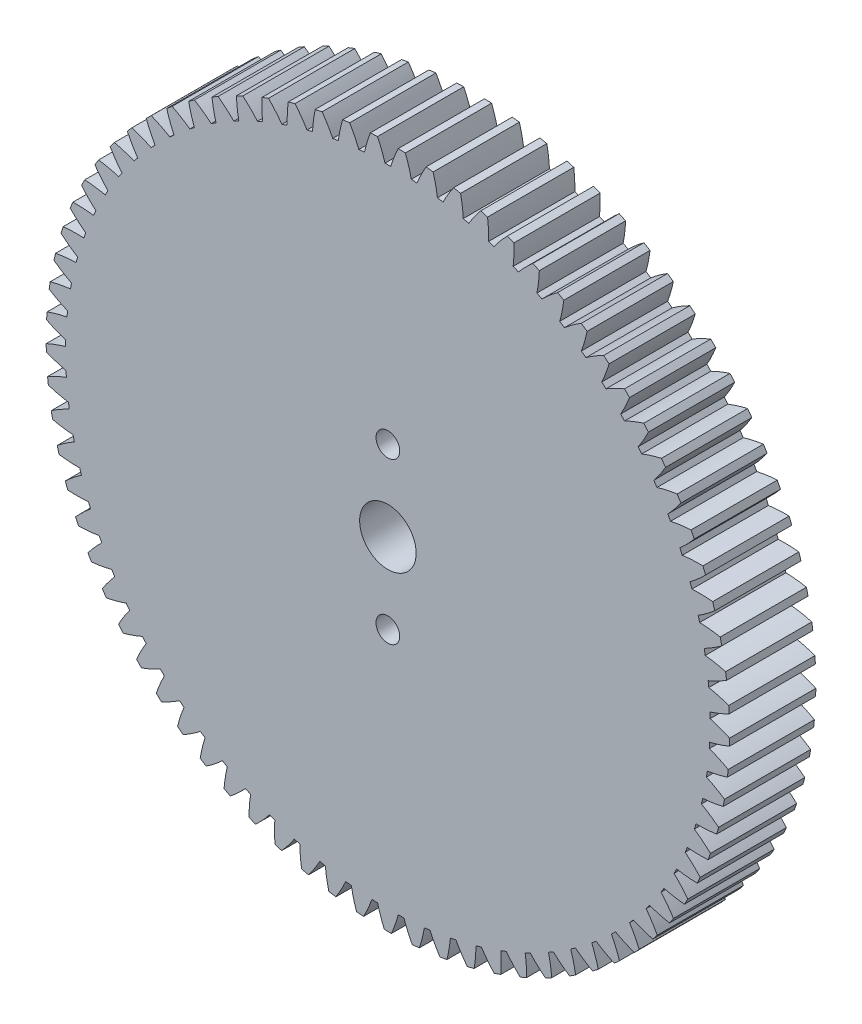
from build123d import *

# Parameters (mm, degrees)
MODEL_R             = 1.375
MODEL_R_2           = 3.275
BOSS_EXTRUDE1_DEPTH = 10


with BuildPart() as part:
    # Model → Boss-Extrude1 (new body)
    with BuildSketch(Plane.XY):
        with BuildLine():
            ThreePointArc((-39.573855354, 2.012609605), (-38.483782884, 1.509137576), (-37.358060536, 1.091416054))
            ThreePointArc((-37.358060536, 1.091416054), (-37.366223524, 0.762374936), (-37.371488451, 0.433274691))
            ThreePointArc((-37.371488451, 0.433274691), (-38.513312242, 0.06181742), (-39.623013466, -0.396773105))
            ThreePointArc((-39.623013466, -0.396773105), (-39.616755155, -0.808292044), (-39.606222982, -1.219723785))
            ThreePointArc((-39.606222982, -1.219723785), (-38.478739993, -1.632669526), (-37.322715212, -1.957244292))
            ThreePointArc((-37.322715212, -1.957244292), (-37.304031133, -2.285855912), (-37.282453816, -2.614290244))
            ThreePointArc((-37.282453816, -2.614290244), (-38.390201066, -3.077580761), (-39.458830466, -3.625096314))
            ThreePointArc((-39.458830466, -3.625096314), (-39.419050364, -4.034735848), (-39.37501773, -4.443940114))
            ThreePointArc((-39.37501773, -4.443940114), (-38.217627437, -4.763611481), (-37.038993376, -4.9928795))
            ThreePointArc((-37.038993376, -4.9928795), (-36.993586569, -5.318874766), (-36.945310601, -5.644457508))
            ThreePointArc((-36.945310601, -5.644457508), (-38.011609436, -6.196498149), (-39.032055459, -6.829295106))
            ThreePointArc((-39.032055459, -6.829295106), (-38.959018298, -7.234329151), (-38.881778232, -7.638582755))
            ThreePointArc((-38.881778232, -7.638582755), (-37.702182875, -7.862852388), (-36.50878315, -7.995287919))
            ThreePointArc((-36.50878315, -7.995287919), (-36.43695579, -8.316497386), (-36.362302441, -8.637061839))
            ThreePointArc((-36.362302441, -8.637061839), (-37.380056817, -9.274178864), (-38.345528563, -9.988046066))
            ThreePointArc((-38.345528563, -9.988046066), (-38.239720392, -10.385779186), (-38.129786915, -10.782391887))
            ThreePointArc((-38.129786915, -10.782391887), (-36.935836507, -10.90976731), (-35.735612996, -10.944489016))
            ThreePointArc((-35.735612996, -10.944489016), (-35.637843082, -11.258775088), (-35.537309157, -11.572187948))
            ThreePointArc((-35.537309157, -11.572187948), (-36.499746087, -12.290141449), (-37.403818501, -13.080328227))
            ThreePointArc((-37.403818501, -13.080328227), (-37.265943457, -13.468113575), (-37.124048157, -13.854445981))
            ThreePointArc((-37.124048157, -13.854445981), (-35.923688241, -13.88407953), (-34.724628233, -13.820856344))
            ThreePointArc((-34.724628233, -13.820856344), (-34.601566408, -14.126127499), (-34.475820943, -14.430303056))
            ThreePointArc((-34.475820943, -14.430303056), (-35.376535569, -15.22431517), (-36.213192198, -16.085562962))
            ThreePointArc((-36.213192198, -16.085562962), (-36.044167816, -16.46081989), (-35.871254983, -16.834301023))
            ThreePointArc((-35.871254983, -16.834301023), (-34.672473757, -16.765995492), (-33.482556799, -16.605248153))
            ThreePointArc((-33.482556799, -16.605248153), (-33.335022018, -16.899472863), (-33.18490183, -17.192386878))
            ThreePointArc((-33.18490183, -17.192386878), (-34.017900043, -18.057173586), (-34.781573076, -18.983750929))
            ThreePointArc((-34.781573076, -18.983750929), (-34.582524185, -19.343982165), (-34.379744526, -19.702126568))
            ThreePointArc((-34.379744526, -19.702126568), (-33.19051968, -19.53633652), (-32.017664473, -19.279134776))
            ThreePointArc((-32.017664473, -19.279134776), (-31.846638557, -19.560355023), (-31.673142669, -19.840058201))
            ThreePointArc((-31.673142669, -19.840058201), (-32.432881005, -20.769864491), (-33.118488324, -21.755605166))
            ThreePointArc((-33.118488324, -21.755605166), (-32.890739561, -22.098413429), (-32.659442541, -22.438837712))
            ThreePointArc((-32.659442541, -22.438837712), (-31.487688171, -22.176666451), (-30.339699873, -21.824721937))
            ThreePointArc((-30.339699873, -21.824721937), (-30.146320971, -22.091066247), (-29.95060397, -22.355697211))
            ThreePointArc((-29.95060397, -22.355697211), (-30.632026495, -23.344335374), (-31.235005496, -24.38267944))
            ThreePointArc((-31.235005496, -24.38267944), (-30.980072493, -24.705783399), (-30.721797355, -25.026222094))
            ThreePointArc((-30.721797355, -25.026222094), (-29.575311292, -24.669414326), (-28.459829575, -24.225069175))
            ThreePointArc((-28.459829575, -24.225069175), (-28.245384592, -24.47476507), (-28.028748944, -24.722562744))
            ThreePointArc((-28.028748944, -24.722562744), (-28.627320902, -25.763453557), (-29.143658859, -26.847491005))
            ThreePointArc((-29.143658859, -26.847491005), (-28.863238153, -27.148740455), (-28.579703676, -27.447061096))
            ThreePointArc((-28.579703676, -27.447061096), (-27.466115596, -26.997991319), (-26.390563808, -26.464202574))
            ThreePointArc((-26.390563808, -26.464202574), (-26.156479839, -26.69558837), (-25.920367217, -26.924903701))
            ThreePointArc((-25.920367217, -26.924903701), (-26.432105212, -28.011120207), (-26.858365982, -29.133636947))
            ThreePointArc((-26.858365982, -29.133636947), (-26.554323725, -29.411027124), (-26.247416784, -29.685244435))
            ThreePointArc((-26.247416784, -29.685244435), (-25.174137433, -29.146901134), (-24.145673192, -28.527221072))
            ThreePointArc((-24.145673192, -28.527221072), (-23.893508028, -28.738756934), (-23.639489723, -28.948063866))
            ThreePointArc((-23.639489723, -28.948063866), (-24.060988223, -30.072377474), (-24.39433511, -31.225903342))
            ThreePointArc((-24.39433511, -31.225903342), (-24.068694654, -31.477588259), (-23.740457664, -31.72587737))
            ThreePointArc((-23.740457664, -31.72587737), (-22.714629538, -31.101843131), (-21.740097106, -30.400395619))
            ThreePointArc((-21.740097106, -30.400395619), (-21.471528863, -30.590673812), (-21.201295325, -30.778579443))
            ThreePointArc((-21.201295325, -30.778579443), (-21.529749327, -31.93350803), (-21.767963963, -33.110366502))
            ThreePointArc((-21.767963963, -33.110366502), (-21.422892392, -33.334671238), (-21.075509715, -33.555379825))
            ThreePointArc((-21.075509715, -33.555379825), (-20.103959532, -32.849807494), (-19.189844259, -32.07126055))
            ThreePointArc((-19.189844259, -32.07126055), (-18.906660217, -32.239014802), (-18.622009805, -32.404268651))
            ThreePointArc((-18.622009805, -32.404268651), (-18.855233502, -33.582126359), (-18.996730607, -34.774485636))
            ThreePointArc((-18.996730607, -34.774485636), (-18.634524314, -34.96991748), (-18.270307727, -35.161576764))
            ThreePointArc((-18.270307727, -35.161576764), (-17.359500991, -34.379161807), (-16.511886166, -33.528696533))
            ThreePointArc((-16.511886166, -33.528696533), (-16.215970866, -33.672810469), (-15.918797882, -33.814312797))
            ThreePointArc((-15.918797882, -33.814312797), (-16.055239208, -35.007261178), (-16.099077143, -36.207186305))
            ThreePointArc((-16.099077143, -36.207186305), (-15.722146553, -36.37244469), (-15.343519855, -36.533779211))
            ThreePointArc((-15.343519855, -36.533779211), (-14.499517836, -35.679728471), (-13.724044194, -34.763004573))
            ThreePointArc((-13.724044194, -34.763004573), (-13.417366904, -34.882519137), (-13.109648986, -34.999328271))
            ThreePointArc((-13.109648986, -34.999328271), (-13.148399947, -36.19942845), (-13.094286977, -37.398934123))
            ThreePointArc((-13.094286977, -37.398934123), (-12.705140499, -37.532919283), (-12.314623389, -37.662855385))
            ThreePointArc((-12.314623389, -37.662855385), (-11.543042782, -36.742852429), (-10.844870973, -35.765970553))
            ThreePointArc((-10.844870973, -35.765970553), (-10.529472579, -35.860090396), (-10.213257538, -35.951428991))
            ThreePointArc((-10.213257538, -35.951428991), (-10.154060253, -37.150694497), (-10.002356492, -38.341798205))
            ThreePointArc((-10.002356492, -38.341798205), (-9.603583832, -38.44361849), (-9.203775137, -38.541291471))
            ThreePointArc((-9.203775137, -38.541291471), (-8.509750682, -37.561458765), (-7.893526924, -36.530919899))
            ThreePointArc((-7.893526924, -36.530919899), (-7.571506352, -36.599018669), (-7.248898547, -36.664278881))
            ThreePointArc((-7.248898547, -36.664278881), (-7.092146963, -37.854728802), (-6.843861974, -39.029503946))
            ThreePointArc((-6.843861974, -39.029503946), (-6.438116899, -39.098481758), (-6.03167728, -39.16324162))
            ThreePointArc((-6.03167728, -39.16324162), (-5.419827596, -38.130099791), (-4.889652756, -37.052762001))
            ThreePointArc((-4.889652756, -37.052762001), (-4.563152999, -37.094386512), (-4.236299331, -37.133134045))
            ThreePointArc((-4.236299331, -37.133134045), (-3.983036606, -38.306846133), (-3.639822684, -39.457474778))
            ThreePointArc((-3.639822684, -39.457474778), (-3.229805361, -39.493151081), (-2.819439605, -39.524566858))
            ThreePointArc((-2.819439605, -39.524566858), (-2.293836451, -38.444991294), (-1.853238756, -37.328024085))
            ThreePointArc((-1.853238756, -37.328024085), (-1.524432615, -37.342897333), (-1.195508243, -37.354874328))
            ThreePointArc((-1.195508243, -37.354874328), (-0.847419797, -38.504037723), (-0.411560974, -39.622862625))
            ThreePointArc((-0.411560974, -39.622862625), (0, -39.625), (0.411560974, -39.622862625))
            ThreePointArc((0.411560974, -39.622862625), (0.847419797, -38.504037723), (1.195508243, -37.354874328))
            ThreePointArc((1.195508243, -37.354874328), (1.524432615, -37.342897333), (1.853238756, -37.328024085))
            ThreePointArc((1.853238756, -37.328024085), (2.293836451, -38.444991294), (2.819439605, -39.524566858))
            ThreePointArc((2.819439605, -39.524566858), (3.229805361, -39.493151081), (3.639822684, -39.457474778))
            ThreePointArc((3.639822684, -39.457474778), (3.983036606, -38.306846133), (4.236299331, -37.133134045))
            ThreePointArc((4.236299331, -37.133134045), (4.563152999, -37.094386512), (4.889652756, -37.052762001))
            ThreePointArc((4.889652756, -37.052762001), (5.419827596, -38.130099791), (6.03167728, -39.16324162))
            ThreePointArc((6.03167728, -39.16324162), (6.438116899, -39.098481758), (6.843861974, -39.029503946))
            ThreePointArc((6.843861974, -39.029503946), (7.092146963, -37.854728802), (7.248898547, -36.664278881))
            ThreePointArc((7.248898547, -36.664278881), (7.571506352, -36.599018669), (7.893526924, -36.530919899))
            ThreePointArc((7.893526924, -36.530919899), (8.509750682, -37.561458765), (9.203775137, -38.541291471))
            ThreePointArc((9.203775137, -38.541291471), (9.603583832, -38.44361849), (10.002356491, -38.341798205))
            ThreePointArc((10.002356491, -38.341798205), (10.154060253, -37.150694497), (10.213257538, -35.951428991))
            ThreePointArc((10.213257538, -35.951428991), (10.529472579, -35.860090396), (10.844870973, -35.765970553))
            ThreePointArc((10.844870973, -35.765970553), (11.543042782, -36.742852429), (12.314623389, -37.662855385))
            ThreePointArc((12.314623389, -37.662855385), (12.705140499, -37.532919283), (13.094286977, -37.398934123))
            ThreePointArc((13.094286977, -37.398934123), (13.148399947, -36.19942845), (13.109648986, -34.999328272))
            ThreePointArc((13.109648986, -34.999328272), (13.417366904, -34.882519137), (13.724044194, -34.763004573))
            ThreePointArc((13.724044194, -34.763004573), (14.499517836, -35.679728471), (15.343519855, -36.533779211))
            ThreePointArc((15.343519855, -36.533779211), (15.722146553, -36.372444691), (16.099077143, -36.207186305))
            ThreePointArc((16.099077143, -36.207186305), (16.055239208, -35.007261178), (15.918797882, -33.814312798))
            ThreePointArc((15.918797882, -33.814312798), (16.215970866, -33.672810469), (16.511886166, -33.528696534))
            ThreePointArc((16.511886166, -33.528696534), (17.359500991, -34.379161808), (18.270307727, -35.161576764))
            ThreePointArc((18.270307727, -35.161576764), (18.634524315, -34.96991748), (18.996730607, -34.774485636))
            ThreePointArc((18.996730607, -34.774485636), (18.855233502, -33.58212636), (18.622009805, -32.404268651))
            ThreePointArc((18.622009805, -32.404268651), (18.906660217, -32.239014803), (19.18984426, -32.07126055))
            ThreePointArc((19.18984426, -32.07126055), (20.103959532, -32.849807494), (21.075509716, -33.555379825))
            ThreePointArc((21.075509716, -33.555379825), (21.422892392, -33.334671238), (21.767963963, -33.110366502))
            ThreePointArc((21.767963963, -33.110366502), (21.529749328, -31.933508031), (21.201295325, -30.778579443))
            ThreePointArc((21.201295325, -30.778579443), (21.471528863, -30.590673812), (21.740097106, -30.40039562))
            ThreePointArc((21.740097106, -30.40039562), (22.714629538, -31.101843132), (23.740457664, -31.72587737))
            ThreePointArc((23.740457664, -31.72587737), (24.068694654, -31.477588259), (24.39433511, -31.225903342))
            ThreePointArc((24.39433511, -31.225903342), (24.060988224, -30.072377474), (23.639489723, -28.948063867))
            ThreePointArc((23.639489723, -28.948063867), (23.893508028, -28.738756934), (24.145673193, -28.527221072))
            ThreePointArc((24.145673193, -28.527221072), (25.174137433, -29.146901135), (26.247416784, -29.685244435))
            ThreePointArc((26.247416784, -29.685244435), (26.554323725, -29.411027124), (26.858365982, -29.133636947))
            ThreePointArc((26.858365982, -29.133636947), (26.432105213, -28.011120208), (25.920367217, -26.924903701))
            ThreePointArc((25.920367217, -26.924903701), (26.156479839, -26.69558837), (26.390563808, -26.464202574))
            ThreePointArc((26.390563808, -26.464202574), (27.466115597, -26.99799132), (28.579703676, -27.447061096))
            ThreePointArc((28.579703676, -27.447061096), (28.863238153, -27.148740456), (29.14365886, -26.847491005))
            ThreePointArc((29.14365886, -26.847491005), (28.627320903, -25.763453557), (28.028748944, -24.722562744))
            ThreePointArc((28.028748944, -24.722562744), (28.245384592, -24.47476507), (28.459829575, -24.225069175))
            ThreePointArc((28.459829575, -24.225069175), (29.575311292, -24.669414327), (30.721797355, -25.026222094))
            ThreePointArc((30.721797355, -25.026222094), (30.980072493, -24.705783399), (31.235005496, -24.38267944))
            ThreePointArc((31.235005496, -24.38267944), (30.632026495, -23.344335374), (29.950603971, -22.355697211))
            ThreePointArc((29.950603971, -22.355697211), (30.146320971, -22.091066247), (30.339699873, -21.824721937))
            ThreePointArc((30.339699873, -21.824721937), (31.487688171, -22.176666451), (32.659442541, -22.438837712))
            ThreePointArc((32.659442541, -22.438837712), (32.890739562, -22.098413429), (33.118488324, -21.755605166))
            ThreePointArc((33.118488324, -21.755605166), (32.432881005, -20.769864491), (31.673142669, -19.840058201))
            ThreePointArc((31.673142669, -19.840058201), (31.846638557, -19.560355023), (32.017664473, -19.279134776))
            ThreePointArc((32.017664473, -19.279134776), (33.19051968, -19.53633652), (34.379744526, -19.702126568))
            ThreePointArc((34.379744526, -19.702126568), (34.582524185, -19.343982165), (34.781573076, -18.983750929))
            ThreePointArc((34.781573076, -18.983750929), (34.017900043, -18.057173586), (33.18490183, -17.192386878))
            ThreePointArc((33.18490183, -17.192386878), (33.335022018, -16.899472863), (33.482556799, -16.605248153))
            ThreePointArc((33.482556799, -16.605248153), (34.672473757, -16.765995492), (35.871254983, -16.834301023))
            ThreePointArc((35.871254983, -16.834301023), (36.044167816, -16.46081989), (36.213192198, -16.085562962))
            ThreePointArc((36.213192198, -16.085562962), (35.376535569, -15.22431517), (34.475820943, -14.430303056))
            ThreePointArc((34.475820943, -14.430303056), (34.601566408, -14.126127499), (34.724628233, -13.820856344))
            ThreePointArc((34.724628233, -13.820856344), (35.923688241, -13.88407953), (37.124048157, -13.854445981))
            ThreePointArc((37.124048157, -13.854445981), (37.265943457, -13.468113575), (37.403818501, -13.080328227))
            ThreePointArc((37.403818501, -13.080328227), (36.499746087, -12.290141449), (35.537309157, -11.572187948))
            ThreePointArc((35.537309157, -11.572187948), (35.637843082, -11.258775088), (35.735612996, -10.944489016))
            ThreePointArc((35.735612996, -10.944489016), (36.935836507, -10.90976731), (38.129786915, -10.782391887))
            ThreePointArc((38.129786915, -10.782391887), (38.239720392, -10.385779186), (38.345528563, -9.988046066))
            ThreePointArc((38.345528563, -9.988046066), (37.380056817, -9.274178864), (36.362302441, -8.637061839))
            ThreePointArc((36.362302441, -8.637061839), (36.43695579, -8.316497386), (36.50878315, -7.995287919))
            ThreePointArc((36.50878315, -7.995287919), (37.702182875, -7.862852388), (38.881778232, -7.638582755))
            ThreePointArc((38.881778232, -7.638582755), (38.959018298, -7.234329151), (39.032055459, -6.829295106))
            ThreePointArc((39.032055459, -6.829295106), (38.011609436, -6.196498149), (36.945310601, -5.644457508))
            ThreePointArc((36.945310601, -5.644457508), (36.993586569, -5.318874766), (37.038993376, -4.9928795))
            ThreePointArc((37.038993376, -4.9928795), (38.217627437, -4.763611481), (39.37501773, -4.443940114))
            ThreePointArc((39.37501773, -4.443940114), (39.419050364, -4.034735848), (39.458830466, -3.625096314))
            ThreePointArc((39.458830466, -3.625096314), (38.390201066, -3.077580761), (37.282453816, -2.614290244))
            ThreePointArc((37.282453816, -2.614290244), (37.304031133, -2.285855912), (37.322715212, -1.957244292))
            ThreePointArc((37.322715212, -1.957244292), (38.478739993, -1.632669526), (39.606222982, -1.219723785))
            ThreePointArc((39.606222982, -1.219723785), (39.616755154, -0.808292044), (39.623013466, -0.396773105))
            ThreePointArc((39.623013466, -0.396773105), (38.513312242, 0.06181742), (37.371488451, 0.433274691))
            ThreePointArc((37.371488451, 0.433274691), (37.366223524, 0.762374936), (37.358060536, 1.091416054))
            ThreePointArc((37.358060536, 1.091416054), (38.483782884, 1.509137576), (39.573855354, 2.012609605))
            ThreePointArc((39.573855354, 2.012609605), (39.550816975, 2.42353081), (39.523511848, 2.834190565))
            ThreePointArc((39.523511848, 2.834190565), (38.380123679, 3.200804215), (37.211821996, 3.477956254))
            ThreePointArc((37.211821996, 3.477956254), (37.179749863, 3.805532305), (37.144794131, 4.132813206))
            ThreePointArc((37.144794131, 4.132813206), (38.232722548, 4.640901616), (39.278130248, 5.231549409))
            ThreePointArc((39.278130248, 5.231549409), (39.221674635, 5.639225467), (39.160987781, 6.046293163))
            ThreePointArc((39.160987781, 6.046293163), (37.991521725, 6.318490187), (36.804517006, 6.499492592))
            ThreePointArc((36.804517006, 6.499492592), (36.745851101, 6.823364484), (36.684335249, 7.146707168))
            ThreePointArc((36.684335249, 7.146707168), (37.727229752, 7.741781222), (38.721015666, 8.415674116))
            ThreePointArc((38.721015666, 8.415674116), (38.63151852, 8.817392008), (38.537853801, 9.218158679))
            ThreePointArc((38.537853801, 9.218158679), (37.350092463, 9.394127649), (36.152284027, 9.477775879))
            ThreePointArc((36.152284027, 9.477775879), (36.067414762, 9.795788298), (35.979748169, 10.113040973))
            ThreePointArc((35.979748169, 10.113040973), (36.970668467, 10.791140551), (37.906219112, 11.543793899))
            ThreePointArc((37.906219112, 11.543793899), (37.784276024, 11.93688026), (37.658256762, 12.328678869))
            ThreePointArc((37.658256762, 12.328678869), (36.460104497, 12.407248741), (35.259463563, 12.392986131))
            ThreePointArc((35.259463563, 12.392986131), (35.148955729, 12.703022757), (35.035721801, 13.012074159))
            ThreePointArc((35.035721801, 13.012074159), (35.968073482, 13.76868662), (36.839162925, 14.595091639))
            ThreePointArc((36.839162925, 14.595091639), (36.685585405, 14.976930544), (36.528050237, 15.357153735))
            ThreePointArc((36.528050237, 15.357153735), (35.327480552, 15.33780164), (34.131997186, 15.225723105))
            ThreePointArc((34.131997186, 15.225723105), (33.996586194, 15.525720696), (33.858538484, 15.824514138))
            ThreePointArc((33.858538484, 15.824514138), (34.726116903, 16.654604351), (35.526948187, 17.549261453))
            ThreePointArc((35.526948187, 17.549261453), (35.342758267, 17.917311826), (35.154755565, 18.283429277))
            ThreePointArc((35.154755565, 18.283429277), (33.959758051, 18.166283999), (32.777388, 17.957135404))
            ThreePointArc((32.777388, 17.957135404), (32.617974988, 18.245097525), (32.456032181, 18.531644586))
            ThreePointArc((32.456032181, 18.531644586), (33.253063745, 19.429688438), (33.97830747, 20.386643826))
            ThreePointArc((33.97830747, 20.386643826), (33.764730904, 20.738456354), (33.547511795, 21.088031614))
            ThreePointArc((33.547511795, 21.088031614), (32.366038964, 20.873872736), (31.204650704, 20.56904593))
            ThreePointArc((31.204650704, 20.56904593), (31.022296539, 20.84305624), (30.837536338, 21.115449998))
            ThreePointArc((30.837536338, 21.115449998), (31.558716935, 22.075471154), (32.203546722, 23.088356448))
            ThreePointArc((32.203546722, 23.088356448), (31.962004829, 23.421589876), (31.717014869, 23.75229658))
            ThreePointArc((31.717014869, 23.75229658), (30.556929228, 23.442549294), (29.424251606, 23.044072849))
            ThreePointArc((29.424251606, 23.044072849), (29.220169826, 23.302307855), (29.013821779, 23.558735573))
            ThreePointArc((29.013821779, 23.558735573), (29.65435207, 24.574345252), (30.214476685, 25.636419868))
            ThreePointArc((30.214476685, 25.636419868), (29.946576884, 25.948856583), (29.675446441, 26.258493931))
            ThreePointArc((29.675446441, 26.258493931), (28.54446817, 25.855219554), (27.448038968, 25.365745264))
            ThreePointArc((27.448038968, 25.365745264), (27.223587703, 25.606486455), (26.997025022, 25.84524165))
            ThreePointArc((26.997025022, 25.84524165), (27.552642385, 26.909681137), (28.02433429, 28.013877143))
            ThreePointArc((28.02433429, 28.013877143), (27.731859411, 28.303437929), (27.436392814, 28.589945337))
            ThreePointArc((27.436392814, 28.589945337), (26.342048385, 28.095827593), (25.289164159, 27.518612831))
            ThreePointArc((25.289164159, 27.518612831), (25.045837095, 27.740258113), (24.800567519, 27.959751908))
            ThreePointArc((24.800567519, 27.959751908), (25.26757441, 29.065937533), (25.647694574, 30.204906688))
            ThreePointArc((25.647694574, 30.204906688), (25.332590989, 30.469664567), (25.014754519, 30.731135373))
            ThreePointArc((25.014754519, 30.731135373), (23.964326614, 30.149462536), (22.961994136, 29.488348569))
            ThreePointArc((22.961994136, 29.488348569), (22.701410574, 29.68942293), (22.43906633, 29.88819463))
            ThreePointArc((22.43906633, 29.88819463), (22.814354897, 31.028764911), (23.100373683, 32.194927562))
            ThreePointArc((23.100373683, 32.194927562), (22.764738353, 32.433120613), (22.42664716, 32.667814774))
            ThreePointArc((22.42664716, 32.667814774), (21.427126203, 32.002457779), (20.48201583, 31.261844212))
            ThreePointArc((20.48201583, 31.261844212), (20.205909912, 31.441009536), (19.928236857, 31.617736348))
            ThreePointArc((19.928236857, 31.617736348), (20.209309616, 32.785100978), (20.399323615, 33.970696505))
            ThreePointArc((20.399323615, 33.970696505), (20.04539014, 34.180739593), (19.689294165, 34.387095258))
            ThreePointArc((19.689294165, 34.387095258), (18.747331803, 33.642481946), (17.865733087, 32.82729744))
            ThreePointArc((17.865733087, 32.82729744), (17.575942252, 32.983361411), (17.284788256, 33.136867247))
            ThreePointArc((17.284788256, 33.136867247), (17.469774713, 34.323257607), (17.562519415, 35.520396067))
            ThreePointArc((17.562519415, 35.520396067), (17.192643162, 35.700891391), (16.820912165, 35.877535296))
            ThreePointArc((16.820912165, 35.877535296), (15.942777003, 35.058620947), (15.130556839, 34.17429042))
            ThreePointArc((15.130556839, 34.17429042), (14.829009596, 34.306214457), (14.52631224, 34.435477762))
            ThreePointArc((14.52631224, 34.435477762), (14.613981343, 35.632998619), (14.608839546, 36.833713255))
            ThreePointArc((14.608839546, 36.833713255), (14.225481981, 36.983459646), (13.84058977, 37.129216256))
            ThreePointArc((13.84058977, 37.129216256), (13.032125652, 36.241450609), (12.294689232, 35.293859136))
            ThreePointArc((12.294689232, 35.293859136), (11.983392329, 35.400765307), (11.671166014, 35.504925854))
            ThreePointArc((11.671166014, 35.504925854), (11.660934337, 36.705607905), (11.55794026, 37.901908157))
            ThreePointArc((11.55794026, 37.901908157), (11.163652565, 38.019909079), (10.768160533, 38.133808408))
            ThreePointArc((10.768160533, 38.133808408), (10.034747655, 37.183099397), (9.377002496, 36.178553042))
            ThreePointArc((9.377002496, 36.178553042), (9.058027562, 36.259729904), (8.738350103, 36.338094522))
            ThreePointArc((8.738350103, 36.338094522), (8.630285738, 37.533947426), (8.430124788, 38.717872114))
            ThreePointArc((8.430124788, 38.717872114), (8.027530882, 38.803342291), (7.624070965, 38.884626357))
            ThreePointArc((7.624070965, 38.884626357), (6.970590069, 37.877300793), (6.396913355, 36.822484646))
            ThreePointArc((6.396913355, 36.822484646), (6.072383117, 36.877391981), (5.747381914, 36.929439166))
            ThreePointArc((5.747381914, 36.929439166), (5.54220401, 38.112504719), (5.246208227, 39.276175021))
            ThreePointArc((5.246208227, 39.276175021), (4.837987306, 39.328545661), (4.429244463, 39.376673533))
            ThreePointArc((4.429244463, 39.376673533), (3.860044355, 38.319435002), (3.374253812, 37.221368691))
            ThreePointArc((3.374253812, 37.221368691), (3.046327963, 37.249641098), (2.718165847, 37.275024486))
            ThreePointArc((2.718165847, 37.275024486), (2.41723983, 38.437429582), (2.027379015, 39.573101462))
            ThreePointArc((2.027379015, 39.573101462), (1.616247723, 39.592024049), (1.204942069, 39.606675443))
            ThreePointArc((1.204942069, 39.606675443), (0.723810683, 38.506559692), (0.329139166, 37.372550668))
            ThreePointArc((0.329139166, 37.372550668), (0, 37.374), (-0.329139166, 37.372550668))
            ThreePointArc((-0.329139166, 37.372550668), (-0.723810683, 38.506559693), (-1.204942069, 39.606675443))
            ThreePointArc((-1.204942069, 39.606675443), (-1.616247723, 39.592024049), (-2.027379015, 39.573101462))
            ThreePointArc((-2.027379015, 39.573101462), (-2.41723983, 38.437429582), (-2.718165847, 37.275024486))
            ThreePointArc((-2.718165847, 37.275024486), (-3.046327963, 37.249641098), (-3.374253812, 37.221368691))
            ThreePointArc((-3.374253812, 37.221368691), (-3.860044355, 38.319435002), (-4.429244463, 39.376673533))
            ThreePointArc((-4.429244463, 39.376673533), (-4.837987306, 39.328545661), (-5.246208227, 39.276175021))
            ThreePointArc((-5.246208227, 39.276175021), (-5.54220401, 38.112504719), (-5.747381914, 36.929439166))
            ThreePointArc((-5.747381914, 36.929439166), (-6.072383117, 36.877391981), (-6.396913355, 36.822484646))
            ThreePointArc((-6.396913355, 36.822484646), (-6.970590069, 37.877300793), (-7.624070965, 38.884626357))
            ThreePointArc((-7.624070965, 38.884626357), (-8.027530882, 38.803342291), (-8.430124788, 38.717872114))
            ThreePointArc((-8.430124788, 38.717872114), (-8.630285738, 37.533947426), (-8.738350103, 36.338094522))
            ThreePointArc((-8.738350103, 36.338094522), (-9.058027562, 36.259729904), (-9.377002496, 36.178553042))
            ThreePointArc((-9.377002496, 36.178553042), (-10.034747655, 37.183099397), (-10.768160533, 38.133808408))
            ThreePointArc((-10.768160533, 38.133808408), (-11.163652565, 38.019909079), (-11.55794026, 37.901908157))
            ThreePointArc((-11.55794026, 37.901908157), (-11.660934337, 36.705607905), (-11.671166014, 35.504925854))
            ThreePointArc((-11.671166014, 35.504925854), (-11.983392329, 35.400765307), (-12.294689232, 35.293859136))
            ThreePointArc((-12.294689232, 35.293859136), (-13.032125652, 36.241450609), (-13.84058977, 37.129216256))
            ThreePointArc((-13.84058977, 37.129216256), (-14.225481981, 36.983459646), (-14.608839546, 36.833713255))
            ThreePointArc((-14.608839546, 36.833713255), (-14.613981343, 35.632998619), (-14.526312241, 34.435477762))
            ThreePointArc((-14.526312241, 34.435477762), (-14.829009596, 34.306214457), (-15.130556839, 34.17429042))
            ThreePointArc((-15.130556839, 34.17429042), (-15.942777003, 35.058620947), (-16.820912165, 35.877535296))
            ThreePointArc((-16.820912165, 35.877535296), (-17.192643163, 35.700891391), (-17.562519415, 35.520396068))
            ThreePointArc((-17.562519415, 35.520396068), (-17.469774713, 34.323257607), (-17.284788256, 33.136867247))
            ThreePointArc((-17.284788256, 33.136867247), (-17.575942252, 32.983361411), (-17.865733088, 32.82729744))
            ThreePointArc((-17.865733088, 32.82729744), (-18.747331803, 33.642481946), (-19.689294165, 34.387095258))
            ThreePointArc((-19.689294165, 34.387095258), (-20.04539014, 34.180739593), (-20.399323615, 33.970696505))
            ThreePointArc((-20.399323615, 33.970696505), (-20.209309616, 32.785100978), (-19.928236857, 31.617736348))
            ThreePointArc((-19.928236857, 31.617736348), (-20.205909912, 31.441009536), (-20.48201583, 31.261844212))
            ThreePointArc((-20.48201583, 31.261844212), (-21.427126204, 32.002457779), (-22.42664716, 32.667814775))
            ThreePointArc((-22.42664716, 32.667814775), (-22.764738353, 32.433120613), (-23.100373683, 32.194927562))
            ThreePointArc((-23.100373683, 32.194927562), (-22.814354897, 31.028764911), (-22.43906633, 29.88819463))
            ThreePointArc((-22.43906633, 29.88819463), (-22.701410575, 29.68942293), (-22.961994136, 29.488348569))
            ThreePointArc((-22.961994136, 29.488348569), (-23.964326614, 30.149462536), (-25.014754519, 30.731135373))
            ThreePointArc((-25.014754519, 30.731135373), (-25.332590989, 30.469664567), (-25.647694574, 30.204906688))
            ThreePointArc((-25.647694574, 30.204906688), (-25.26757441, 29.065937533), (-24.800567519, 27.959751908))
            ThreePointArc((-24.800567519, 27.959751908), (-25.045837096, 27.740258113), (-25.289164159, 27.518612831))
            ThreePointArc((-25.289164159, 27.518612831), (-26.342048385, 28.095827593), (-27.436392814, 28.589945337))
            ThreePointArc((-27.436392814, 28.589945337), (-27.731859411, 28.303437929), (-28.02433429, 28.013877143))
            ThreePointArc((-28.02433429, 28.013877143), (-27.552642385, 26.909681137), (-26.997025022, 25.84524165))
            ThreePointArc((-26.997025022, 25.84524165), (-27.223587703, 25.606486455), (-27.448038968, 25.365745264))
            ThreePointArc((-27.448038968, 25.365745264), (-28.54446817, 25.855219554), (-29.675446442, 26.258493931))
            ThreePointArc((-29.675446442, 26.258493931), (-29.946576884, 25.948856583), (-30.214476685, 25.636419868))
            ThreePointArc((-30.214476685, 25.636419868), (-29.65435207, 24.574345252), (-29.013821779, 23.558735573))
            ThreePointArc((-29.013821779, 23.558735573), (-29.220169826, 23.302307855), (-29.424251606, 23.044072849))
            ThreePointArc((-29.424251606, 23.044072849), (-30.556929228, 23.442549294), (-31.717014869, 23.75229658))
            ThreePointArc((-31.717014869, 23.75229658), (-31.962004829, 23.421589876), (-32.203546723, 23.088356449))
            ThreePointArc((-32.203546723, 23.088356449), (-31.558716935, 22.075471154), (-30.837536338, 21.115449998))
            ThreePointArc((-30.837536338, 21.115449998), (-31.022296539, 20.84305624), (-31.204650704, 20.56904593))
            ThreePointArc((-31.204650704, 20.56904593), (-32.366038965, 20.873872736), (-33.547511795, 21.088031614))
            ThreePointArc((-33.547511795, 21.088031614), (-33.764730905, 20.738456354), (-33.97830747, 20.386643826))
            ThreePointArc((-33.97830747, 20.386643826), (-33.253063745, 19.429688438), (-32.456032181, 18.531644586))
            ThreePointArc((-32.456032181, 18.531644586), (-32.617974988, 18.245097525), (-32.777388, 17.957135404))
            ThreePointArc((-32.777388, 17.957135404), (-33.959758051, 18.166283999), (-35.154755565, 18.283429277))
            ThreePointArc((-35.154755565, 18.283429277), (-35.342758267, 17.917311826), (-35.526948187, 17.549261453))
            ThreePointArc((-35.526948187, 17.549261453), (-34.726116903, 16.654604351), (-33.858538484, 15.824514138))
            ThreePointArc((-33.858538484, 15.824514138), (-33.996586194, 15.525720696), (-34.131997186, 15.225723105))
            ThreePointArc((-34.131997186, 15.225723105), (-35.327480552, 15.33780164), (-36.528050237, 15.357153735))
            ThreePointArc((-36.528050237, 15.357153735), (-36.685585405, 14.976930544), (-36.839162925, 14.595091639))
            ThreePointArc((-36.839162925, 14.595091639), (-35.968073482, 13.76868662), (-35.035721801, 13.012074159))
            ThreePointArc((-35.035721801, 13.012074159), (-35.148955729, 12.703022757), (-35.259463563, 12.392986131))
            ThreePointArc((-35.259463563, 12.392986131), (-36.460104497, 12.407248741), (-37.658256762, 12.328678869))
            ThreePointArc((-37.658256762, 12.328678869), (-37.784276024, 11.93688026), (-37.906219113, 11.543793899))
            ThreePointArc((-37.906219113, 11.543793899), (-36.970668467, 10.791140551), (-35.979748169, 10.113040973))
            ThreePointArc((-35.979748169, 10.113040973), (-36.067414762, 9.795788298), (-36.152284027, 9.477775879))
            ThreePointArc((-36.152284027, 9.477775879), (-37.350092463, 9.394127648), (-38.537853801, 9.218158679))
            ThreePointArc((-38.537853801, 9.218158679), (-38.63151852, 8.817392008), (-38.721015666, 8.415674116))
            ThreePointArc((-38.721015666, 8.415674116), (-37.727229752, 7.741781222), (-36.684335249, 7.146707168))
            ThreePointArc((-36.684335249, 7.146707168), (-36.745851101, 6.823364484), (-36.804517006, 6.499492592))
            ThreePointArc((-36.804517006, 6.499492592), (-37.991521725, 6.318490187), (-39.160987781, 6.046293163))
            ThreePointArc((-39.160987781, 6.046293163), (-39.221674635, 5.639225467), (-39.278130248, 5.231549409))
            ThreePointArc((-39.278130248, 5.231549409), (-38.232722548, 4.640901616), (-37.144794131, 4.132813206))
            ThreePointArc((-37.144794131, 4.132813206), (-37.179749863, 3.805532305), (-37.211821996, 3.477956254))
            ThreePointArc((-37.211821996, 3.477956254), (-38.380123679, 3.200804215), (-39.523511849, 2.834190565))
            ThreePointArc((-39.523511849, 2.834190565), (-39.550816975, 2.42353081), (-39.573855354, 2.012609605))
        make_face()
        with Locations((0, -9.3)):
            Circle(MODEL_R, mode=Mode.SUBTRACT)
        Circle(MODEL_R_2, mode=Mode.SUBTRACT)
        with Locations((0, 9.3)):
            Circle(MODEL_R, mode=Mode.SUBTRACT)
    extrude(amount=BOSS_EXTRUDE1_DEPTH)


solid = part.part
